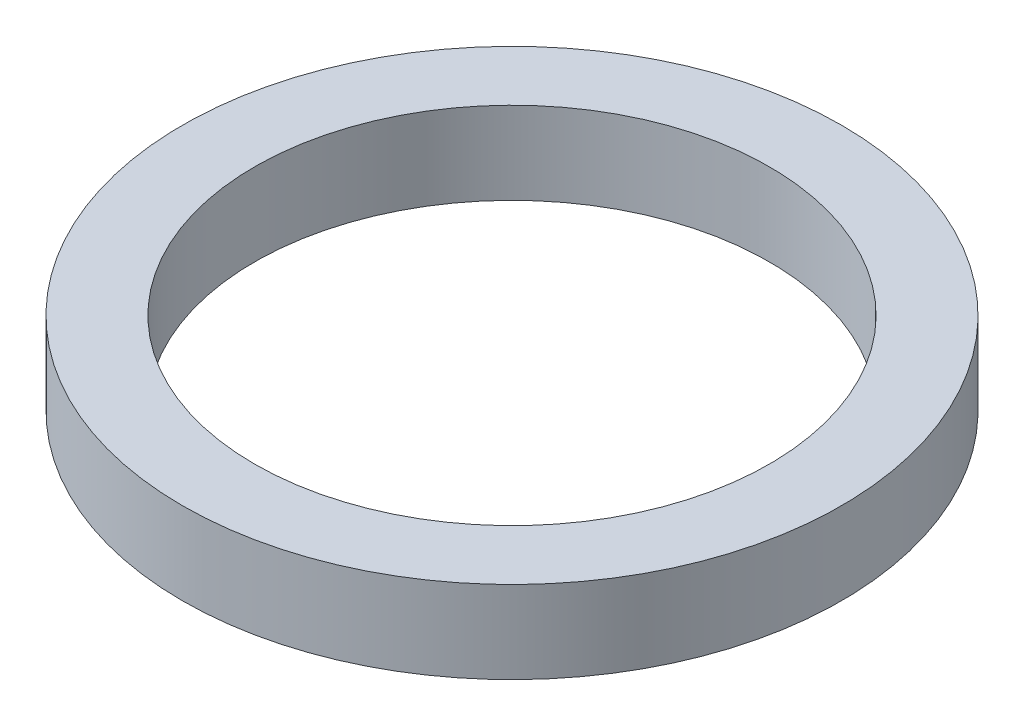
from build123d import *

# Parameters (mm, degrees)
SKETCH1_R           = 16
SKETCH1_R_2         = 12.5
BOSS_EXTRUDE1_DEPTH = 4


with BuildPart() as part:
    # Sketch1 → Boss-Extrude1 (new body)
    with BuildSketch(Plane(origin=(0, 19, 0), x_dir=(1, 0, 0), z_dir=(0, 1, 0))):
        with Locations((-0.5, 0)):
            Circle(SKETCH1_R)
        with Locations((-0.5, 0)):
            Circle(SKETCH1_R_2, mode=Mode.SUBTRACT)
    extrude(amount=BOSS_EXTRUDE1_DEPTH)


solid = part.part
